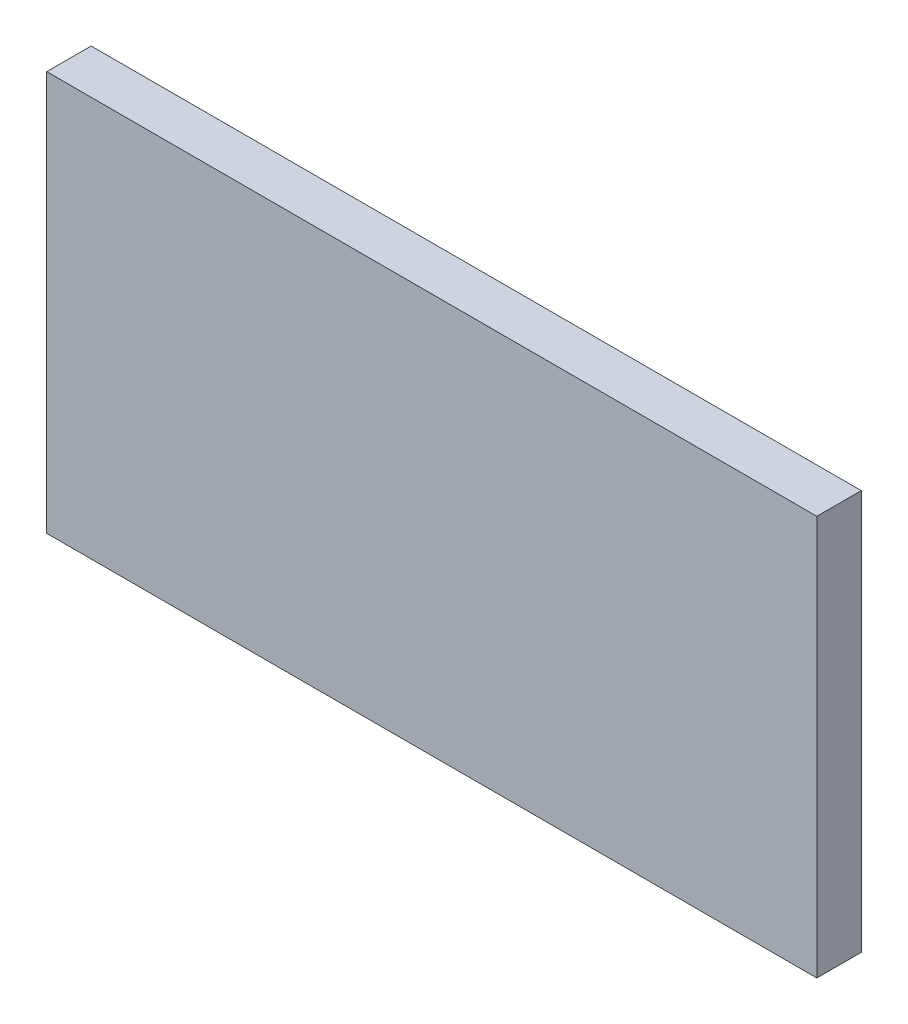
from build123d import *

# Parameters (mm, degrees)
SKETCH1_W           = 330.2
SKETCH1_H           = 171.45
BOSS_EXTRUDE1_DEPTH = 19.05


with BuildPart() as part:
    # Sketch1 → Boss-Extrude1 (new body)
    with BuildSketch(Plane.XY):
        Rectangle(SKETCH1_W, SKETCH1_H)
    extrude(amount=BOSS_EXTRUDE1_DEPTH)


solid = part.part
